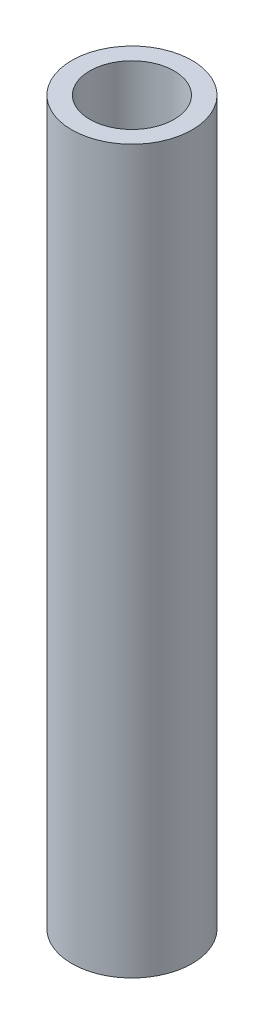
from build123d import *

# Parameters (mm, degrees)
FEED_TUBE_SKETCH_R   = 10
FEED_TUBE_SKETCH_R_2 = 7
FEED_TUBE_DEPTH      = 120


with BuildPart() as part:
    # Feed Tube Sketch → Feed Tube (new body)
    with BuildSketch(Plane(origin=(0, 0, 0), x_dir=(1, 0, 0), z_dir=(0, 1, 0))):
        Circle(FEED_TUBE_SKETCH_R)
        Circle(FEED_TUBE_SKETCH_R_2, mode=Mode.SUBTRACT)
    extrude(amount=FEED_TUBE_DEPTH)


solid = part.part
